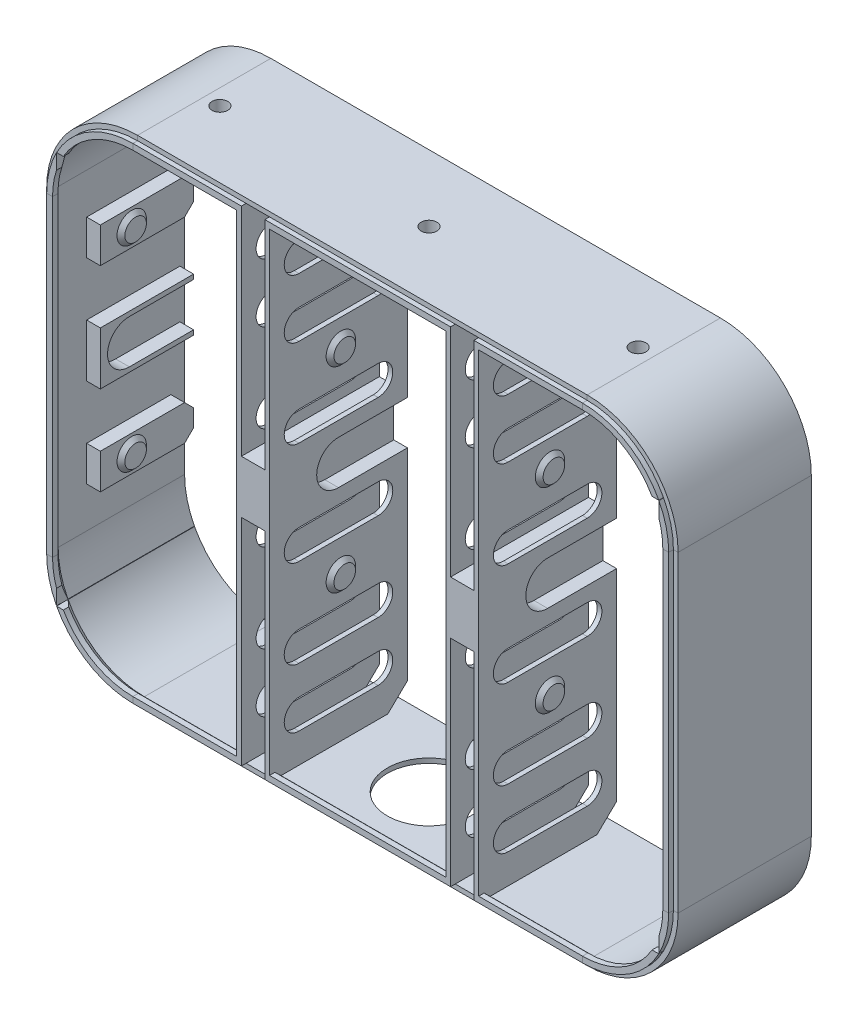
from build123d import *

# Parameters (mm, degrees)
CROSSBRACE_REACH          = 413.998
SKETCH16_W                = 16.75
SKETCH16_H                = 70.4
CLEARANCE_DEPTH           = 16.75
SKETCH42_W                = 11.95
SKETCH42_H                = 247.5
CLEARANCE2_DEPTH          = 70.4
SKETCH36_W                = 11.95
SKETCH36_H                = 27
BOSS_EXTRUDE16_DEPTH      = 70.4
BEARINGCUTOUT1_DEPTH      = 7
BEARINGCUTOUT2_START      = 7
BEARINGCUTOUT2_DEPTH      = 7
SKETCH26_W                = 9.86
SKETCH26_H                = 20.5
SPOOLCLEARANCE_DEPTH      = 412.997791256
SKETCH23_W                = 50
SKETCH23_H                = 27
SUPPORT_FOR_BEARING_DEPTH = 7
BEARINGCUTOUT3_START      = 7
BEARINGCUTOUT3_DEPTH      = 7
SKETCH29_R                = 7.5
BOSS1_DEPTH               = 2
BOSS2_START               = 2
SKETCH30_R                = 7.5
BOSS2_DEPTH               = 2
SKETCH33_W                = 50
SKETCH33_H                = 18
BOSSSUPPORT1_DEPTH        = 7
SKETCH31_R                = 7.5
BOSS3_DEPTH               = 2
CHAMFER3_SIZE             = 2
FILLET1_SIZE              = 7
SIDEHOLES_REACH           = 344.185
SKETCH46_W                = 2.4
SKETCH46_H                = 108.8
TRIMEDGE1_DEPTH           = 7
SKETCH40_R                = 8
BOSS5_DEPTH               = 4
BOSS5_DRAFT               = 45
BOSS5_PROFILE_2_DEPTH     = 4
BOSS5_PROFILE_2_DRAFT     = 45
BOSS5_PROFILE_3_DEPTH     = 4
BOSS5_PROFILE_3_DRAFT     = 45
FILAMENTHOLES_REACH       = 415.458
SKETCH27_R                = 4
HUMITYSENSOR_REACH        = 415.458
SKETCH43_R                = 21.25


# Read off the part's stored shape, not the designer's step: Mirror1
with BuildPart() as part:
    # Sweep2: sweep along a path in BasketRing
    with BuildLine(Plane.XY) as sweep2_path:
        Line((44, 0), (273.5, 0))
        ThreePointArc((273.5, 0), (304.612698372, 12.887301628), (317.5, 44))
        Line((317.5, 44), (317.5, 203.5))
        ThreePointArc((317.5, 203.5), (304.612698372, 234.612698372), (273.5, 247.5))
        Line((273.5, 247.5), (44, 247.5))
        ThreePointArc((44, 247.5), (12.887301628, 234.612698372), (0, 203.5))
        Line((0, 203.5), (0, 44))
        ThreePointArc((0, 44), (12.887301628, 12.887301628), (44, 0))
    # ShapeOf Edge → Sweep2 (sweep)
    with BuildSketch(Plane(origin=(44, 0, 0), x_dir=(0, 0, -1), z_dir=(1, 0, 0))):
        Polygon((0, 0), (2.4, 0), (2.4, -2.4), (70.4, -2.4), (70.4, 0), (5.854935695, 0), (2.748344754, 3), (0, 3), align=None)
    sweep(path=sweep2_path.line)

    # Sketch16 → CrossBrace (add, up to next)
    with BuildSketch(Plane.XZ.offset(-247.5), mode=Mode.PRIVATE) as crossbrace_sk1:
        with Locations((105.375, -35.2)):
            Rectangle(SKETCH16_W, SKETCH16_H)
    crossbrace_tool1 = extrude(crossbrace_sk1.sketch, amount=CROSSBRACE_REACH, mode=Mode.PRIVATE) - part.part
    crossbrace = crossbrace_tool1.solids().sort_by_distance((105.375, 247.5, -35.2))[0]
    add(crossbrace)

    # Sketch41 → Clearance (cut)
    with BuildSketch(Plane.ZY.offset(-97)):
        Polygon((-70.4, 247.5), (-69.6, 247.5), (-60.4, 247.5), (-70.4, 237.144696862), align=None)
        Polygon((-70.4, 0), (-70.4, 9.656887748), (-60.4, 0), align=None)
    clearance = extrude(amount=-CLEARANCE_DEPTH, mode=Mode.SUBTRACT)

    # Mirror3: CrossBrace, Clearance across plane
    add(crossbrace.mirror(Plane(origin=(158.75, 0, 0), x_dir=(0, 0, 1), z_dir=(1, 0, 0))))
    add(clearance.mirror(Plane(origin=(158.75, 0, 0), x_dir=(0, 0, 1), z_dir=(1, 0, 0))), mode=Mode.SUBTRACT)

    # Sketch42 → Clearance2 (cut)
    with BuildSketch(Plane(origin=(0, 0, -70.4), x_dir=(-1, 0, 0), z_dir=(0, 0, -1))):
        with Locations((-212.125, 123.75)):
            Rectangle(SKETCH42_W, SKETCH42_H)
        with Locations((-105.375, 123.75)):
            Rectangle(SKETCH42_W, SKETCH42_H)
    extrude(amount=-CLEARANCE2_DEPTH, mode=Mode.SUBTRACT)

    # Sketch36 → Boss-Extrude16 (add)
    with BuildSketch(Plane(origin=(0, 0, 0), x_dir=(-1, 0, 0), z_dir=(0, 0, -1))):
        with Locations((-105.375, 123.400792305)):
            Rectangle(SKETCH36_W, SKETCH36_H)
    extrude(amount=BOSS_EXTRUDE16_DEPTH)

    # Sketch17 → BearingCutout1 (cut)
    with BuildSketch(Plane(origin=(113.75, 0, 0), x_dir=(0, 0, -1), z_dir=(1, 0, 0))):
        with BuildLine():
            Line((35.2, 134.875), (70.4, 134.875))
            Line((70.4, 134.875), (70.4, 112.625))
            Line((70.4, 112.625), (35.2, 112.625))
            ThreePointArc((35.2, 112.625), (24.075, 123.75), (35.2, 134.875))
        make_face()
    extrude(amount=-BEARINGCUTOUT1_DEPTH, mode=Mode.SUBTRACT)

    # Sketch20 → BearingCutout2 (cut)
    with BuildSketch(Plane(origin=(97, 0, 0), x_dir=(0, 0, -1), z_dir=(1, 0, 0)).offset(BEARINGCUTOUT2_START)):
        with BuildLine():
            Line((70.4, 112.625), (70.4, 134.875))
            Line((70.4, 134.875), (35.2, 134.875))
            ThreePointArc((35.2, 134.875), (24.075, 123.75), (35.2, 112.625))
            Line((35.2, 112.625), (70.4, 112.625))
        make_face()
    extrude(amount=-BEARINGCUTOUT2_DEPTH, mode=Mode.SUBTRACT)

    # Sketch26 → SpoolClearance (cut, through all)
    with BuildSketch(Plane.XY):
        with Locations((9.93, 213.75)):
            Rectangle(SKETCH26_W, SKETCH26_H)
        with Locations((9.93, 33.75)):
            Rectangle(SKETCH26_W, SKETCH26_H)
    extrude(amount=-SPOOLCLEARANCE_DEPTH, mode=Mode.SUBTRACT)

    # Sketch23 → Support For Bearing (add)
    with BuildSketch(Plane.ZY):
        with Locations((-45.4, 123.75)):
            Rectangle(SKETCH23_W, SKETCH23_H)
    extrude(amount=-SUPPORT_FOR_BEARING_DEPTH)

    # Sketch35 → BearingCutout3 (cut)
    with BuildSketch(Plane(origin=(0, 0, 0), x_dir=(0, 0, -1), z_dir=(1, 0, 0)).offset(BEARINGCUTOUT3_START)):
        with BuildLine():
            Line((35.2, 112.625), (70.4, 112.625))
            Line((70.4, 112.625), (70.4, 134.875))
            Line((70.4, 134.875), (35.2, 134.875))
            ThreePointArc((35.2, 134.875), (24.075, 123.75), (35.2, 112.625))
        make_face()
    extrude(amount=-BEARINGCUTOUT3_DEPTH, mode=Mode.SUBTRACT)

    # Sketch29 → Boss1 (add)
    with BuildSketch(Plane(origin=(113.75, 0, 0), x_dir=(0, 0, -1), z_dir=(1, 0, 0))):
        with Locations(Location((36.4, 173.75, 0), (0, 0, 180))):
            Circle(SKETCH29_R)
        with Locations(Location((36.4, 73.75, 0), (0, 0, 180))):
            Circle(SKETCH29_R)
    extrude(amount=BOSS1_DEPTH)

    # Sketch30 → Boss2 (add)
    with BuildSketch(Plane.ZY.offset(-97).offset(BOSS2_START)):
        with Locations((-36.4, 173.75)):
            Circle(SKETCH30_R)
        with Locations((-36.4, 73.75)):
            Circle(SKETCH30_R)
    extrude(amount=-BOSS2_DEPTH)

    # Sketch33 → BossSupport1 (add)
    with BuildSketch(Plane.ZY):
        with Locations((-45.4, 173.75)):
            Rectangle(SKETCH33_W, SKETCH33_H)
        with Locations((-45.4, 73.75)):
            Rectangle(SKETCH33_W, SKETCH33_H)
    extrude(amount=-BOSSSUPPORT1_DEPTH)

    # Sketch31 → Boss3 (add)
    with BuildSketch(Plane.ZY.offset(-7)):
        with Locations((-36.4, 173.75)):
            Circle(SKETCH31_R)
        with Locations((-36.4, 73.75)):
            Circle(SKETCH31_R)
    extrude(amount=-BOSS3_DEPTH)

    # Chamfer3
    chamfer3_edges = [part.edges().sort_by_distance(p)[0] for p in [
        (115.75, 173.75, -43.9),
        (115.75, 73.75, -43.9),
        (95, 173.75, -43.9),
        (95, 73.75, -43.9),
        (9, 173.75, -43.9),
        (9, 73.75, -43.9),
    ]]
    chamfer(chamfer3_edges, length=CHAMFER3_SIZE - 0.0001)  # a hair under: the kernel refuses the full size

    # Fillet1
    fillet1_edges = [part.edges().sort_by_distance(p)[0] for p in [
        (3.5, 164.75, -70.4),
        (3.5, 182.75, -70.4),
        (3.5, 64.75, -70.4),
        (3.5, 82.75, -70.4),
    ]]
    chamfer(fillet1_edges, length=FILLET1_SIZE)

    # SideHoles: up to this face of the body (flat: up to its plane)
    sideholes_end = Plane(part.part.faces().sort_by_distance((113.75, 241.926822781, -1.374172377))[0])
    # Sketch34 → SideHoles (cut, up to the picked face)
    with BuildSketch(Plane.ZY.offset(-97), mode=Mode.PRIVATE) as sideholes_sk1:
        with BuildLine():
            Line((-15, 217.4), (-55.4, 217.4))
            ThreePointArc((-55.4, 217.4), (-62.9, 224.9), (-55.4, 232.4))
            Line((-55.4, 232.4), (-15, 232.4))
            ThreePointArc((-15, 232.4), (-7.5, 224.9), (-15, 217.4))
        make_face()
    sideholes_tool1 = split(extrude(sideholes_sk1.sketch, amount=-SIDEHOLES_REACH, mode=Mode.PRIVATE), bisect_by=sideholes_end, keep=Keep.BOTH, mode=Mode.PRIVATE)
    # Sketch34 → SideHoles (cut, up to the picked face)
    with BuildSketch(Plane.ZY.offset(-97), mode=Mode.PRIVATE) as sideholes_sk2:
        with BuildLine():
            Line((-15, 187.4), (-55.4, 187.4))
            ThreePointArc((-55.4, 187.4), (-62.9, 194.9), (-55.4, 202.4))
            Line((-55.4, 202.4), (-15, 202.4))
            ThreePointArc((-15, 202.4), (-7.5, 194.9), (-15, 187.4))
        make_face()
    sideholes_tool2 = split(extrude(sideholes_sk2.sketch, amount=-SIDEHOLES_REACH, mode=Mode.PRIVATE), bisect_by=sideholes_end, keep=Keep.BOTH, mode=Mode.PRIVATE)
    # Sketch34 → SideHoles (cut, up to the picked face)
    with BuildSketch(Plane.ZY.offset(-97), mode=Mode.PRIVATE) as sideholes_sk3:
        with BuildLine():
            Line((-15, 142.4), (-55.4, 142.4))
            ThreePointArc((-55.4, 142.4), (-62.9, 149.9), (-55.4, 157.4))
            Line((-55.4, 157.4), (-15, 157.4))
            ThreePointArc((-15, 157.4), (-7.5, 149.9), (-15, 142.4))
        make_face()
    sideholes_tool3 = split(extrude(sideholes_sk3.sketch, amount=-SIDEHOLES_REACH, mode=Mode.PRIVATE), bisect_by=sideholes_end, keep=Keep.BOTH, mode=Mode.PRIVATE)
    # Sketch34 → SideHoles (cut, up to the picked face)
    with BuildSketch(Plane.ZY.offset(-97), mode=Mode.PRIVATE) as sideholes_sk4:
        with BuildLine():
            Line((-15, 90.1), (-55.4, 90.1))
            ThreePointArc((-55.4, 90.1), (-62.9, 97.6), (-55.4, 105.1))
            Line((-55.4, 105.1), (-15, 105.1))
            ThreePointArc((-15, 105.1), (-7.5, 97.6), (-15, 90.1))
        make_face()
    sideholes_tool4 = split(extrude(sideholes_sk4.sketch, amount=-SIDEHOLES_REACH, mode=Mode.PRIVATE), bisect_by=sideholes_end, keep=Keep.BOTH, mode=Mode.PRIVATE)
    # Sketch34 → SideHoles (cut, up to the picked face)
    with BuildSketch(Plane.ZY.offset(-97), mode=Mode.PRIVATE) as sideholes_sk5:
        with BuildLine():
            Line((-15, 45.1), (-55.4, 45.1))
            ThreePointArc((-55.4, 45.1), (-62.9, 52.6), (-55.4, 60.1))
            Line((-55.4, 60.1), (-15, 60.1))
            ThreePointArc((-15, 60.1), (-7.5, 52.6), (-15, 45.1))
        make_face()
    sideholes_tool5 = split(extrude(sideholes_sk5.sketch, amount=-SIDEHOLES_REACH, mode=Mode.PRIVATE), bisect_by=sideholes_end, keep=Keep.BOTH, mode=Mode.PRIVATE)
    # Sketch34 → SideHoles (cut, up to the picked face)
    with BuildSketch(Plane.ZY.offset(-97), mode=Mode.PRIVATE) as sideholes_sk6:
        with BuildLine():
            Line((-15, 15.1), (-55.4, 15.1))
            ThreePointArc((-55.4, 15.1), (-62.9, 22.6), (-55.4, 30.1))
            Line((-55.4, 30.1), (-15, 30.1))
            ThreePointArc((-15, 30.1), (-7.5, 22.6), (-15, 15.1))
        make_face()
    sideholes_tool6 = split(extrude(sideholes_sk6.sketch, amount=-SIDEHOLES_REACH, mode=Mode.PRIVATE), bisect_by=sideholes_end, keep=Keep.BOTH, mode=Mode.PRIVATE)
    add(sideholes_tool1.solids().sort_by(Axis((97, 224.9, -35.2), (1, 0, 0)))[0], mode=Mode.SUBTRACT)
    add(sideholes_tool2.solids().sort_by(Axis((97, 194.9, -35.2), (1, 0, 0)))[0], mode=Mode.SUBTRACT)
    add(sideholes_tool3.solids().sort_by(Axis((97, 149.9, -35.2), (1, 0, 0)))[0], mode=Mode.SUBTRACT)
    add(sideholes_tool4.solids().sort_by(Axis((97, 97.6, -35.2), (1, 0, 0)))[0], mode=Mode.SUBTRACT)
    add(sideholes_tool5.solids().sort_by(Axis((97, 52.6, -35.2), (1, 0, 0)))[0], mode=Mode.SUBTRACT)
    add(sideholes_tool6.solids().sort_by(Axis((97, 22.6, -35.2), (1, 0, 0)))[0], mode=Mode.SUBTRACT)

    # Sketch46 → TrimEdge1 (cut)
    with BuildSketch(Plane(origin=(0, 0, 0), x_dir=(0, 0, -1), z_dir=(1, 0, 0))):
        with Locations((69.2, 123.75)):
            Rectangle(SKETCH46_W, SKETCH46_H)
    extrude(amount=TRIMEDGE1_DEPTH, mode=Mode.SUBTRACT)

    # Mirror1
    split(bisect_by=Plane(origin=(158.75, 0, 0), x_dir=(0, 0, 1), z_dir=(1, 0, 0)), keep=Keep.BOTTOM)

    # Mirror1 2: part across plane


with BuildPart() as part_1:
    add(part.part)
    add(part.part.mirror(Plane(origin=(158.75, 0, 0), x_dir=(0, 0, 1), z_dir=(1, 0, 0))))


with BuildPart() as boss5_tool:
    # Sketch40 → Boss5 (with draft: the straight prism first)
    with BuildSketch(Plane.XZ.offset(-247.5)):
        with Locations((52, -36.4)):
            Circle(SKETCH40_R)
    extrude(amount=BOSS5_DEPTH)
    # Boss5: the draft: its side faces are tilted about the plane it starts from
    boss5_sides = [boss5_tool.faces().sort_by_distance(p)[0] for p in [
        (44, 245.5, -36.4),
    ]]
    draft(boss5_sides, Plane.XZ.offset(-247.5), BOSS5_DRAFT)


with BuildPart() as part_2:
    add(part_1.part)

    # Boss5: add boss5_tool
    add(boss5_tool.part)


with BuildPart() as boss5_profile_2_tool:
    # Sketch40 → Boss5 profile 2 (with draft: the straight prism first)
    with BuildSketch(Plane.XZ.offset(-247.5)):
        with Locations((158.75, -36.4)):
            Circle(SKETCH40_R)
    extrude(amount=BOSS5_PROFILE_2_DEPTH)
    # Boss5 profile 2: the draft: its side faces are tilted about the plane it starts from
    boss5_profile_2_sides = [boss5_profile_2_tool.faces().sort_by_distance(p)[0] for p in [
        (150.75, 245.5, -36.4),
    ]]
    draft(boss5_profile_2_sides, Plane.XZ.offset(-247.5), BOSS5_PROFILE_2_DRAFT)


with BuildPart() as part_3:
    add(part_2.part)

    # Boss5 profile 2: add boss5_profile_2_tool
    add(boss5_profile_2_tool.part)


with BuildPart() as boss5_profile_3_tool:
    # Sketch40 → Boss5 profile 3 (with draft: the straight prism first)
    with BuildSketch(Plane.XZ.offset(-247.5)):
        with Locations((265.5, -36.4)):
            Circle(SKETCH40_R)
    extrude(amount=BOSS5_PROFILE_3_DEPTH)
    # Boss5 profile 3: the draft: its side faces are tilted about the plane it starts from
    boss5_profile_3_sides = [boss5_profile_3_tool.faces().sort_by_distance(p)[0] for p in [
        (257.5, 245.5, -36.4),
    ]]
    draft(boss5_profile_3_sides, Plane.XZ.offset(-247.5), BOSS5_PROFILE_3_DRAFT)


with BuildPart() as part_4:
    add(part_3.part)

    # Boss5 profile 3: add boss5_profile_3_tool
    add(boss5_profile_3_tool.part)

    # FilamentHoles: up to this face of the body (flat: up to its plane)
    filamentholes_end = Plane(part_4.part.faces().sort_by_distance((52, 243.5, -36.4))[0])
    # Sketch27 → FilamentHoles (cut, up to the picked face)
    with BuildSketch(Plane(origin=(0, 249.9, 0), x_dir=(1, 0, 0), z_dir=(0, 1, 0)), mode=Mode.PRIVATE) as filamentholes_sk1:
        with Locations(Location((158.75, 36.4, 0), (0, 0, 180))):
            Circle(SKETCH27_R)
    filamentholes_tool1 = split(extrude(filamentholes_sk1.sketch, amount=-FILAMENTHOLES_REACH, mode=Mode.PRIVATE), bisect_by=filamentholes_end, keep=Keep.BOTH, mode=Mode.PRIVATE)
    # Sketch27 → FilamentHoles (cut, up to the picked face)
    with BuildSketch(Plane(origin=(0, 249.9, 0), x_dir=(1, 0, 0), z_dir=(0, 1, 0)), mode=Mode.PRIVATE) as filamentholes_sk2:
        with Locations(Location((265.5, 36.4, 0), (0, 0, 180))):
            Circle(SKETCH27_R)
    filamentholes_tool2 = split(extrude(filamentholes_sk2.sketch, amount=-FILAMENTHOLES_REACH, mode=Mode.PRIVATE), bisect_by=filamentholes_end, keep=Keep.BOTH, mode=Mode.PRIVATE)
    # Sketch27 → FilamentHoles (cut, up to the picked face)
    with BuildSketch(Plane(origin=(0, 249.9, 0), x_dir=(1, 0, 0), z_dir=(0, 1, 0)), mode=Mode.PRIVATE) as filamentholes_sk3:
        with Locations(Location((52, 36.4, 0), (0, 0, 180))):
            Circle(SKETCH27_R)
    filamentholes_tool3 = split(extrude(filamentholes_sk3.sketch, amount=-FILAMENTHOLES_REACH, mode=Mode.PRIVATE), bisect_by=filamentholes_end, keep=Keep.BOTH, mode=Mode.PRIVATE)
    add(filamentholes_tool1.solids().sort_by(Axis((158.75, 249.9, -36.4), (0, -1, 0)))[0], mode=Mode.SUBTRACT)
    add(filamentholes_tool2.solids().sort_by(Axis((265.5, 249.9, -36.4), (0, -1, 0)))[0], mode=Mode.SUBTRACT)
    add(filamentholes_tool3.solids().sort_by(Axis((52, 249.9, -36.4), (0, -1, 0)))[0], mode=Mode.SUBTRACT)

    # Sketch43 → HumitySensor (cut, up to next)
    with BuildSketch(Plane.XZ.offset(2.4), mode=Mode.PRIVATE) as humitysensor_sk1:
        with Locations(Location((158.75, -36.4, 0), (0, 0, 270))):
            Circle(SKETCH43_R)
    humitysensor_tool1 = extrude(humitysensor_sk1.sketch, amount=-HUMITYSENSOR_REACH, mode=Mode.PRIVATE) & part_4.part
    add(humitysensor_tool1.solids().sort_by_distance((158.75, -2.4, -36.4))[0], mode=Mode.SUBTRACT)


solid = part_4.part
